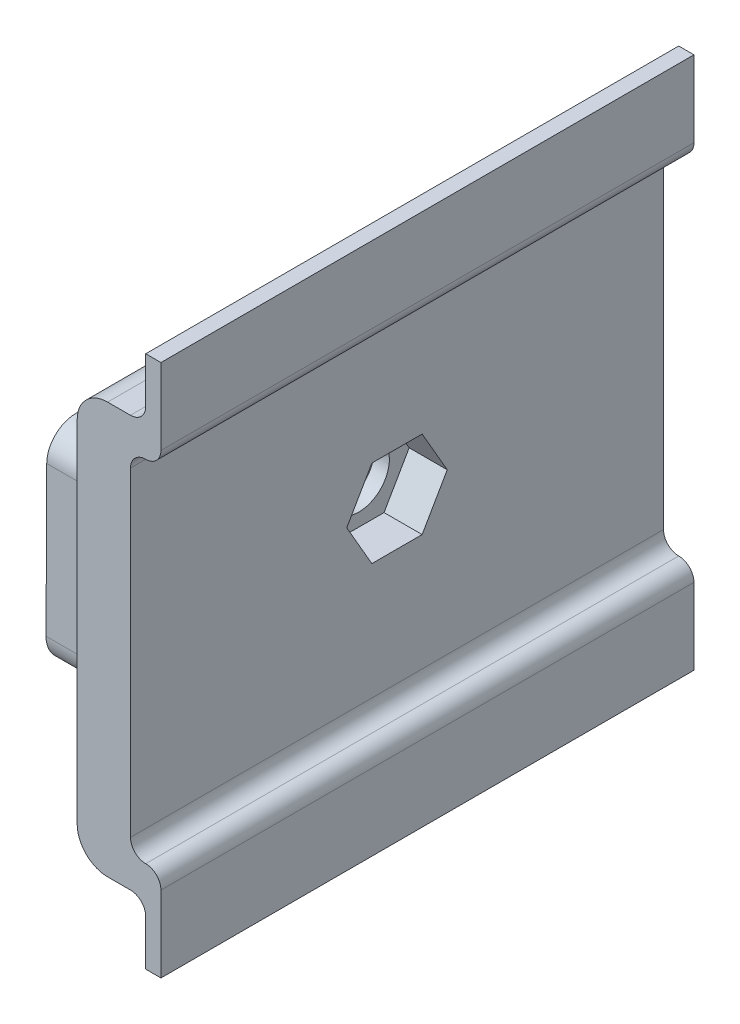
from build123d import *

# Parameters (mm, degrees)
EXTRUDE_1_DEPTH     = 35
FILLET_START        = -36
FILLET_1_DEPTH      = 37
FILLET_START_2      = -35
FILLET_1_2_DEPTH    = 35
SKETCH_2_R          = 2
CUT_EXTRUDE_1_DEPTH = 40.515819617
CUT_EXTRUDE_2_DEPTH = 2.5
EXTRUDE_2_DEPTH     = 5.1


with BuildPart() as part:
    # 草图1 → 凸台-拉伸1 (new body)
    with BuildSketch(Plane.XY):
        with BuildLine():
            Line((-2, 11.5), (-2, -11.5))
            Line((-2, -11.5), (0, -11.5))
            Line((0, -11.5), (0, -14.5))
            Line((0, -14.5), (0, -17.5))
            Line((0, -17.5), (-1, -17.5))
            Line((-1, -17.5), (-1, -14.5))
            ThreePointArc((-1, -14.5), (-1.292893219, -13.792893219), (-2, -13.5))
            Line((-2, -13.5), (-3.5, -13.5))
            ThreePointArc((-3.5, -13.5), (-4.914213562, -12.914213562), (-5.5, -11.5))
            Line((-5.5, -11.5), (-5.5, 11.5))
            ThreePointArc((-5.5, 11.5), (-4.914213562, 12.914213562), (-3.5, 13.5))
            Line((-3.5, 13.5), (-2, 13.5))
            ThreePointArc((-2, 13.5), (-1.292893219, 13.792893219), (-1, 14.5))
            Line((-1, 14.5), (-1, 17.5))
            Line((-1, 17.5), (0, 17.5))
            Line((0, 17.5), (0, 14.5))
            Line((0, 14.5), (0, 11.5))
            Line((0, 11.5), (-2, 11.5))
        make_face()
    extrude(amount=-EXTRUDE_1_DEPTH)

    # 圆角1: read off the stored shape, not the designer's step
    # 圆角1 outline → 圆角1 (cut)
    with BuildSketch(Plane.XY.offset(FILLET_START)):
        with BuildLine():
            Line((0, -11.5), (-1, -11.5))
            ThreePointArc((-1, -11.5), (-0.292893219, -11.792893219), (0, -12.5))
            Line((0, -12.5), (0, -11.5))
        make_face()
        with BuildLine():
            ThreePointArc((0, 12.5), (-0.292893219, 11.792893219), (-1, 11.5))
            Line((-1, 11.5), (0, 11.5))
            Line((0, 11.5), (0, 12.5))
        make_face()
    extrude(amount=FILLET_1_DEPTH, mode=Mode.SUBTRACT)

    # Fillet 1 2 outline → Fillet 1 2 (add)
    with BuildSketch(Plane.XY.offset(FILLET_START_2)):
        with BuildLine():
            Line((-2, -11.5), (-1, -11.5))
            ThreePointArc((-1, -11.5), (-1.707106781, -11.207106781), (-2, -10.5))
            Line((-2, -10.5), (-2, -11.5))
        make_face()
        with BuildLine():
            Line((-2, 11.5), (-2, 10.5))
            ThreePointArc((-2, 10.5), (-1.707106781, 11.207106781), (-1, 11.5))
            Line((-1, 11.5), (-2, 11.5))
        make_face()
    extrude(amount=FILLET_1_2_DEPTH)

    # 草图2 → 切除-拉伸1 (cut, through all)
    with BuildSketch(Plane.ZY.offset(5.5)):
        with Locations(Location((-17.5, 0, 0), (0, 0, 270))):
            Circle(SKETCH_2_R)
    extrude(amount=-CUT_EXTRUDE_1_DEPTH, mode=Mode.SUBTRACT)

    # 草图3 → 切除-拉伸2 (cut)
    with BuildSketch(Plane(origin=(-2, 0, 0), x_dir=(0, 0, -1), z_dir=(1, 0, 0))):
        Polygon((19.15, -2.857883832), (20.8, 0), (19.15, 2.857883832), (15.85, 2.857883832), (14.2, 0), (15.85, -2.857883832), align=None)
    extrude(amount=-CUT_EXTRUDE_2_DEPTH, mode=Mode.SUBTRACT)

    # 草图4 → 凸台-拉伸2 (add)
    with BuildSketch(Plane.ZY.offset(5.5)):
        with BuildLine():
            Line((-3.055300855, -4.891227974), (-3.100019781, 4.908669996))
            ThreePointArc((-3.100019781, 4.908669996), (-5, 6.8), (-6.899980219, 4.908669996))
            Line((-6.899980219, 4.908669996), (-6.944699145, -4.891227974))
            ThreePointArc((-6.944699145, -4.891227974), (-5, -6.844821423), (-3.055300855, -4.891227974))
        make_face()
        with BuildLine():
            Line((-31.899980219, 4.908669996), (-31.944699145, -4.891227974))
            ThreePointArc((-31.944699145, -4.891227974), (-30, -6.844821423), (-28.055300855, -4.891227974))
            Line((-28.055300855, -4.891227974), (-28.100019781, 4.908669996))
            ThreePointArc((-28.100019781, 4.908669996), (-30, 6.8), (-31.899980219, 4.908669996))
        make_face()
    extrude(amount=EXTRUDE_2_DEPTH)


solid = part.part
